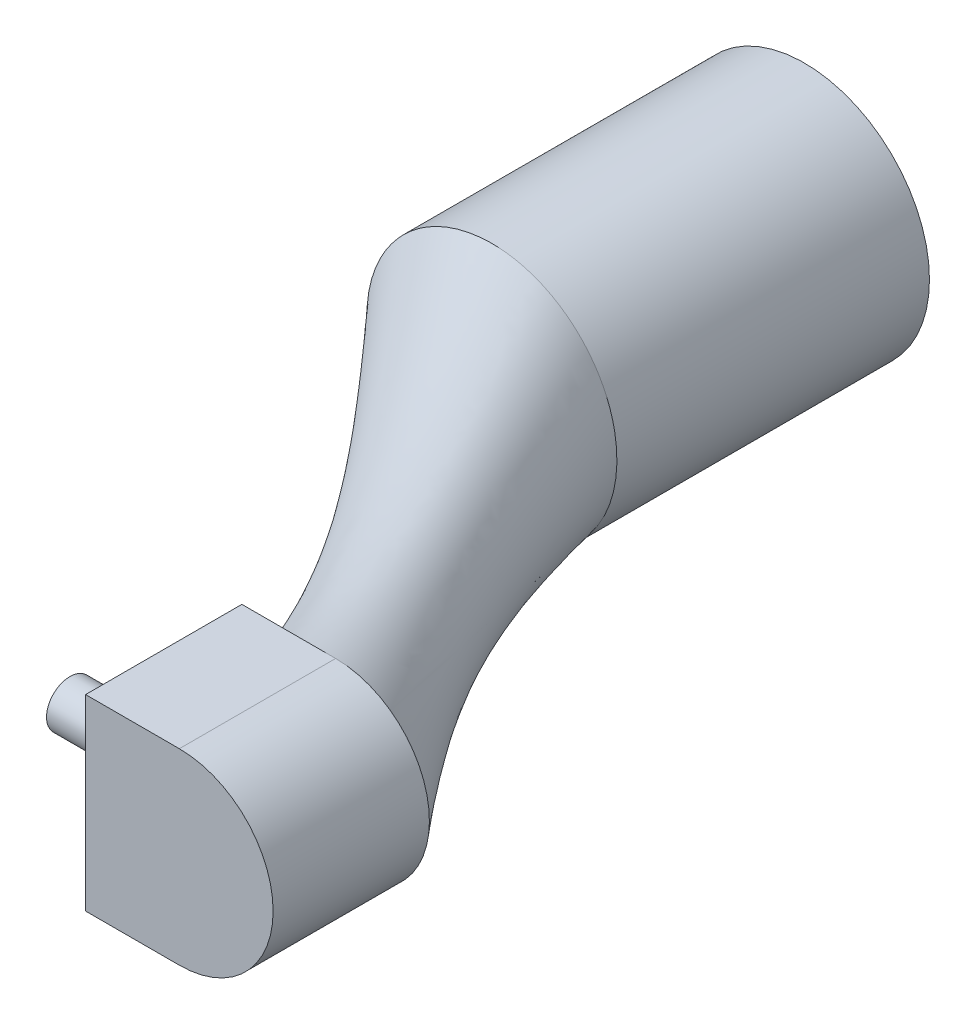
from build123d import *

# Parameters (mm, degrees)
SKETCH1_R                            = 4
BOSS_EXTRUDE1_DEPTH                  = 10
SKETCH1_4_R                          = 2
CUT_EXTRUDE1_DEPTH                   = 5
SKETCH6_R                            = 3
BOSS_EXTRUDE2_DEPTH                  = 5
SKETCH7_R                            = 0.75
BOSS_EXTRUDE3_DEPTH                  = 3
BOSS_EXTRUDE3_DIRECTION_2_REACH      = 31.682
BOSS_EXTRUDE3_DIRECTION_2_END_RADIUS = 3
BOSS_EXTRUDE4_REACH                  = 31.682
BOSS_EXTRUDE4_END_RADIUS             = 3
SKETCH9_W                            = 5
SKETCH9_H                            = 6


with BuildPart() as part:
    # Sketch1 → Boss-Extrude1 (new body)
    with BuildSketch(Plane.XY):
        Circle(SKETCH1_R)
    extrude(amount=BOSS_EXTRUDE1_DEPTH)

    # Sketch1<4> → Cut-Extrude1 (cut)
    with BuildSketch(Plane.XY):
        Circle(SKETCH1_4_R)
    extrude(amount=CUT_EXTRUDE1_DEPTH, mode=Mode.SUBTRACT)

    # Loft1: read off the stored shape, not the designer's step
    # Loft1: loft between two sections, ruled curve by curve
    loft1_from = [
        Edge.make_bspline([(3.385367761, -2.130559814, 10), (3.562914412, -1.848445834, 10), (3.729450124, -1.507728827, 10), (3.963569473, -0.68714007, 10), (4.030199805, -0.204777875, 10), (3.964845244, 0.592548145, 10), (3.915208142, 0.869797638, 10), (3.747214936, 1.42960937, 10), (3.628664886, 1.712079095, 10), (3.317375032, 2.25686654, 10), (3.124520878, 2.51894579, 10), (2.672129968, 2.994568423, 10), (2.412673794, 3.20782111, 10), (1.848445834, 3.562914412, 10), (1.543941138, 3.704586936, 10), (0.919424528, 3.906709247, 10), (0.599709563, 3.967212135, 10), (-0.026126607, 4.012199033, 10), (-0.332082278, 3.996889301, 10), (-0.909475606, 3.906181876, 10), (-1.180913753, 3.830999063, 10), (-1.928047455, 3.545007399, 10), (-2.334117327, 3.276269334, 10), (-2.972675278, 2.710211456, 10), (-3.20782111, 2.412673794, 10), (-3.562914412, 1.848445834, 10), (-3.729450124, 1.507728827, 10), (-3.963569473, 0.68714007, 10), (-4.030199805, 0.204777875, 10), (-3.964845244, -0.592548145, 10), (-3.915208142, -0.869797638, 10), (-3.747214936, -1.42960937, 10), (-3.628664886, -1.712079095, 10), (-3.317375032, -2.25686654, 10), (-3.124520878, -2.51894579, 10), (-2.672129968, -2.994568423, 10), (-2.412673794, -3.20782111, 10), (-1.848445834, -3.562914412, 10), (-1.543941138, -3.704586936, 10), (-0.919424528, -3.906709247, 10), (-0.599709563, -3.967212135, 10), (0.026126607, -4.012199033, 10), (0.332082278, -3.996889301, 10), (0.909475606, -3.906181876, 10), (1.180913753, -3.830999063, 10), (1.928047455, -3.545007399, 10), (2.334117327, -3.276269334, 10), (2.972675278, -2.710211456, 10), (3.20782111, -2.412673794, 10), (3.385367761, -2.130559814, 10)], [0, 0, 0, 0, 0.0625, 0.0625, 0.125, 0.125, 0.15625, 0.15625, 0.1875, 0.1875, 0.21875, 0.21875, 0.25, 0.25, 0.28125, 0.28125, 0.3125, 0.3125, 0.34375, 0.34375, 0.375, 0.375, 0.4375, 0.4375, 0.5, 0.5, 0.5625, 0.5625, 0.625, 0.625, 0.65625, 0.65625, 0.6875, 0.6875, 0.71875, 0.71875, 0.75, 0.75, 0.78125, 0.78125, 0.8125, 0.8125, 0.84375, 0.84375, 0.875, 0.875, 0.9375, 0.9375, 1, 1, 1, 1], 3),
    ]
    loft1_to = [
        Edge.make_bspline([(9.743472659, 2.441373197, 23), (9.540024893, 2.586662585, 23), (9.29221759, 2.726274693, 23), (8.688080925, 2.937506534, 23), (8.329845163, 3.008521592, 23), (7.730008732, 2.994512434, 23), (7.520252392, 2.969491752, 23), (7.093752041, 2.868231802, 23), (6.877068802, 2.79184327, 23), (6.455541, 2.582636196, 23), (6.250869976, 2.449721592, 23), (5.874946982, 2.131839906, 23), (5.703916191, 1.946920425, 23), (5.413337415, 1.540024893, 23), (5.293926981, 1.318241454, 23), (5.115239974, 0.859506435, 23), (5.055936651, 0.622779512, 23), (4.994842263, 0.156173936, 23), (4.99290402, -0.073571743, 23), (5.035528487, -0.509850646, 23), (5.07993029, -0.716374826, 23), (5.261333283, -1.288295235, 23), (5.444756854, -1.604098645, 23), (5.840606651, -2.106993204, 23), (6.053079575, -2.296083809, 23), (6.459975107, -2.586662585, 23), (6.70778241, -2.726274693, 23), (7.311919075, -2.937506534, 23), (7.670154837, -3.008521592, 23), (8.269991268, -2.994512434, 23), (8.479747608, -2.969491752, 23), (8.906247959, -2.868231802, 23), (9.122931198, -2.79184327, 23), (9.544459, -2.582636196, 23), (9.749130024, -2.449721592, 23), (10.125053018, -2.131839906, 23), (10.296083809, -1.946920425, 23), (10.586662585, -1.540024893, 23), (10.706073019, -1.318241454, 23), (10.884760026, -0.859506435, 23), (10.944063349, -0.622779512, 23), (11.005157737, -0.156173936, 23), (11.00709598, 0.073571743, 23), (10.964471513, 0.509850646, 23), (10.92006971, 0.716374826, 23), (10.738666717, 1.288295235, 23), (10.555243146, 1.604098645, 23), (10.159393349, 2.106993204, 23), (9.946920425, 2.296083809, 23), (9.743472659, 2.441373197, 23)], [0, 0, 0, 0, 0.0625, 0.0625, 0.125, 0.125, 0.15625, 0.15625, 0.1875, 0.1875, 0.21875, 0.21875, 0.25, 0.25, 0.28125, 0.28125, 0.3125, 0.3125, 0.34375, 0.34375, 0.375, 0.375, 0.4375, 0.4375, 0.5, 0.5, 0.5625, 0.5625, 0.625, 0.625, 0.65625, 0.65625, 0.6875, 0.6875, 0.71875, 0.71875, 0.75, 0.75, 0.78125, 0.78125, 0.8125, 0.8125, 0.84375, 0.84375, 0.875, 0.875, 0.9375, 0.9375, 1, 1, 1, 1], 3),
    ]
    loft1 = Solid(Shell([*[Face.make_surface_from_curves(loft1_from[k], loft1_to[k]) for k in range(1)], Face(Wire(loft1_from)), Face(Wire(loft1_to))]))
    add(loft1)

    # Sketch6 → Boss-Extrude2 (add)
    with BuildSketch(Plane.XY.offset(23)):
        with Locations((8, 0)):
            Circle(SKETCH6_R)
    extrude(amount=BOSS_EXTRUDE2_DEPTH)

    # Sketch7 → Boss-Extrude3 (add)
    with BuildSketch(Plane.ZY.offset(-5)):
        with Locations((25.5, 0)):
            Circle(SKETCH7_R)
    extrude(amount=BOSS_EXTRUDE3_DEPTH)

    # Boss-Extrude3 direction 2: up to this cylinder (the profile starts outside it)
    boss_extrude3_direction_2_end = Plane(origin=(8, 0, 25.5), z_dir=(0, 0, -1)) * Cylinder(BOSS_EXTRUDE3_DIRECTION_2_END_RADIUS, 70.364, mode=Mode.PRIVATE)
    # Sketch7 → Boss-Extrude3 direction 2 (add, up to the surface)
    with BuildSketch(Plane.ZY.offset(-5), mode=Mode.PRIVATE) as boss_extrude3_direction_2_sk1:
        with Locations((25.5, 0)):
            Circle(SKETCH7_R)
    boss_extrude3_direction_2_tool1 = extrude(boss_extrude3_direction_2_sk1.sketch, amount=-BOSS_EXTRUDE3_DIRECTION_2_REACH, mode=Mode.PRIVATE) - boss_extrude3_direction_2_end
    add(boss_extrude3_direction_2_tool1.solids().sort_by_distance((5, 0, 25.5))[0])
    add(boss_extrude3_direction_2_tool1.solids().sort_by_distance((5, 0, 25.5))[1])

    # Boss-Extrude4: up to this cylinder (the profile starts outside it)
    boss_extrude4_end = Plane(origin=(8, 0, 25.5), z_dir=(0, 0, -1)) * Cylinder(BOSS_EXTRUDE4_END_RADIUS, 70.364, mode=Mode.PRIVATE)
    # Sketch9 → Boss-Extrude4 (add, up to the surface)
    with BuildSketch(Plane.ZY.offset(-5), mode=Mode.PRIVATE) as boss_extrude4_sk1:
        with Locations((25.5, 0)):
            Rectangle(SKETCH9_W, SKETCH9_H)
    boss_extrude4_tool1 = extrude(boss_extrude4_sk1.sketch, amount=-BOSS_EXTRUDE4_REACH, mode=Mode.PRIVATE) - boss_extrude4_end
    add(boss_extrude4_tool1.solids().sort_by_distance((5, 0, 25.5))[0])
    add(boss_extrude4_tool1.solids().sort_by_distance((5, 0, 25.5))[1])


solid = part.part
